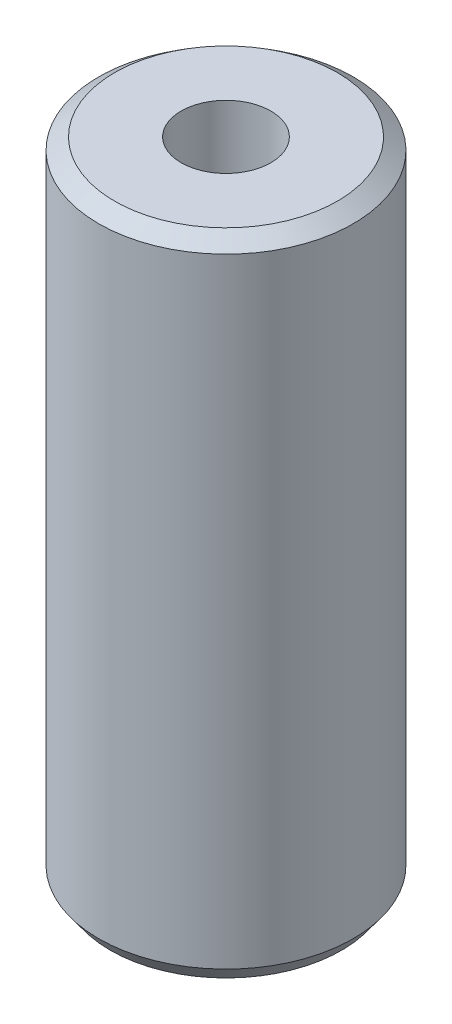
from build123d import *
from OCP.BRepFilletAPI import BRepFilletAPI_MakeChamfer

# Parameters (mm, degrees)
SKETCH1_R           = 42.5
BOSS_EXTRUDE1_DEPTH = 215.93689725
SKETCH2_R           = 14.975319725
CUT_EXTRUDE1_DEPTH  = 225.145585711
CHAMFER1_SIZE       = 3.875238426
CHAMFER1_SIZE2      = 5.303702864


with BuildPart() as part:
    # Sketch1 → Boss-Extrude1 (new body)
    with BuildSketch(Plane(origin=(0, 0, 0), x_dir=(1, 0, 0), z_dir=(0, 1, 0))):
        Circle(SKETCH1_R)
    extrude(amount=BOSS_EXTRUDE1_DEPTH)

    # Sketch2 → Cut-Extrude1 (cut, through all)
    with BuildSketch(Plane(origin=(0, 0, 0), x_dir=(1, 0, 0), z_dir=(0, 1, 0))):
        Circle(SKETCH2_R)
    extrude(amount=CUT_EXTRUDE1_DEPTH, mode=Mode.SUBTRACT)

    # Chamfer1: one chamfer whose edges measure the first distance from different faces: ONE call of the kernel's chamfer builder (chamfer() names one face for all edges)
    chamfer1_edges_1 = [part.edges().sort_by_distance(p)[0] for p in [
        (-42.5, 215.93689725, 0),
    ]]
    chamfer1_side_1 = [part.faces().sort_by_distance(p)[0] for p in [
        (-42.5, 107.968448625, 0),
    ]]
    chamfer1_edges_2 = [part.edges().sort_by_distance(p)[0] for p in [
        (-42.5, 0, 0),
    ]]
    chamfer1_side_2 = [part.faces().sort_by_distance(p)[0] for p in [
        (-41.297918472, 0, 0),
    ]]
    chamfer1 = BRepFilletAPI_MakeChamfer(part.part.solid().wrapped)
    for e in chamfer1_edges_1:
        chamfer1.Add(CHAMFER1_SIZE, CHAMFER1_SIZE2, e.wrapped, chamfer1_side_1[0].wrapped)  # the first distance lies on this face
    for e in chamfer1_edges_2:
        chamfer1.Add(CHAMFER1_SIZE, CHAMFER1_SIZE2, e.wrapped, chamfer1_side_2[0].wrapped)  # the first distance lies on this face
    add(Compound.cast(chamfer1.Shape()), mode=Mode.REPLACE)


solid = part.part
